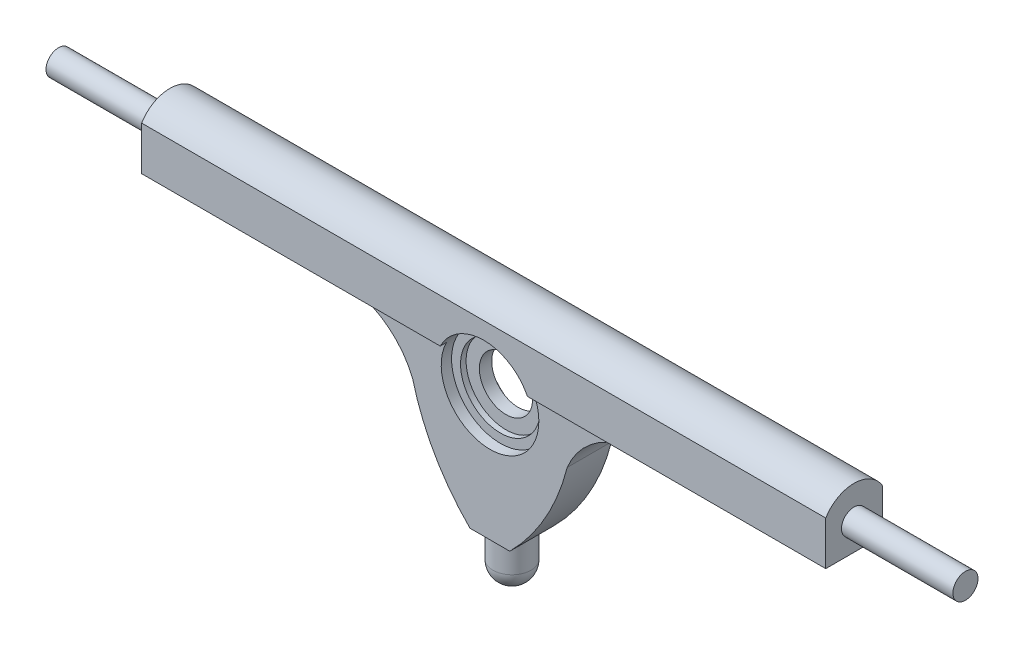
from build123d import *

# Parameters (mm, degrees)
BOSS_EXTRUDE1_DEPTH = 109
BOSS_EXTRUDE2_DEPTH = 7.0485
SKETCH11_R          = 4
BOSS_EXTRUDE3_DEPTH = 35.5


with BuildPart() as part:
    # Sketch1 → Boss-Extrude1 (new, symmetric)
    with BuildSketch(Plane(origin=(0, 0, 0), x_dir=(0, 0, -1), z_dir=(1, 0, 0))):
        with BuildLine():
            Line((-9.017, -6.985), (9.017, -6.985))
            Line((9.017, -6.985), (9.017, 6.985))
            ThreePointArc((9.017, 6.985), (0, 12.065), (-9.017, 6.985))
            Line((-9.017, 6.985), (-9.017, -6.985))
        make_face()
    extrude(amount=BOSS_EXTRUDE1_DEPTH, both=True)

    # 3DSketch1 → Boss-Extrude2 (add, symmetric)
    with BuildSketch(Plane(origin=(6.35, -54.483, 0), x_dir=(-0.707809670892054, 0.7064031920876931, 0), z_dir=(0, 0, -1))):
        with BuildLine():
            Line((0, 0), (8.98918282, -8.97132054))
            ThreePointArc((8.98918282, -8.97132054), (27.524857468, -6.428824004), (44.720760252, 0.942502247))
            ThreePointArc((44.720760252, 0.942502247), (56.955852786, 2.786694427), (68.610551817, -1.368606356))
            Line((68.610551817, -1.368606356), (7.484108639, 59.636373313))
            ThreePointArc((7.484108639, 59.636373313), (11.662583103, 47.989962481), (9.842730909, 35.751225941))
            ThreePointArc((9.842730909, 35.751225941), (2.50562293, 18.54069516), (0, 0))
        make_face()
    extrude(amount=BOSS_EXTRUDE2_DEPTH, both=True)

    # Sketch8 → Revolve2 (revolve)
    with BuildSketch(Plane.XY):
        with BuildLine():
            Line((0, -69.469), (0, -54.483))
            Line((0, -54.483), (6.096, -54.483))
            Line((6.096, -54.483), (6.096, -63.373))
            ThreePointArc((6.096, -63.373), (4.310522938, -67.683522938), (0, -69.469))
        make_face()
    revolve(axis=Axis((0, -47.134198832, 0), (0, -1, 0)))

    # Sketch10 → Cut-Revolve1 (revolve, cut)
    with BuildSketch(Plane(origin=(0, -13.977260066, 0), x_dir=(-1, 0, 0), z_dir=(0, -1, 0))):
        Polygon((-0.050623963, -9.017), (-0.050623963, 9.017), (-15.608123963, 9.017), (-15.608123963, 3.7465), (-12.750623963, 3.7465), (-12.750623963, 1.9685), (-8.534223963, 1.9685), (-8.534223963, -1.9685), (-12.750623963, -1.9685), (-12.750623963, -3.7465), (-15.608123963, -3.7465), (-15.608123963, -9.017), align=None)
    revolve(axis=Axis((0.050623963, -13.977260066, 55.769949285), (0, 0, -1)), mode=Mode.SUBTRACT)

    # Sketch11 → Boss-Extrude3 (add)
    with BuildSketch(Plane(origin=(109, 0, 0), x_dir=(0, 0, -1), z_dir=(1, 0, 0))):
        with Locations((0, 1.5224125)):
            Circle(SKETCH11_R)
    boss_extrude3 = extrude(amount=BOSS_EXTRUDE3_DEPTH)

    # Mirror1: Boss-Extrude3 across plane
    add(boss_extrude3.mirror(Plane(origin=(0, 0, 0), x_dir=(0, 0, 1), z_dir=(1, 0, 0))))


solid = part.part
